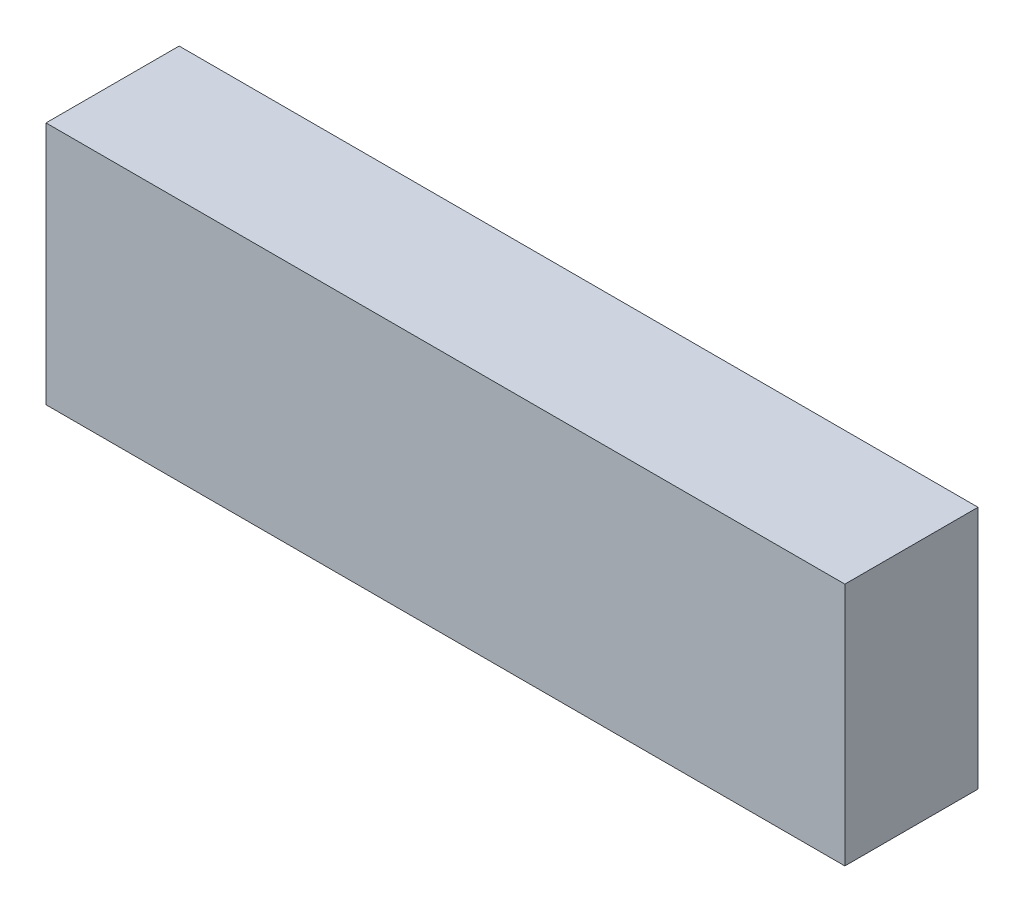
from build123d import *

# Parameters (mm, degrees)
SKETCH1_W           = 180
SKETCH1_H           = 55
BOSS_EXTRUDE1_DEPTH = 30


with BuildPart() as part:
    # Sketch1 → Boss-Extrude1 (new body)
    with BuildSketch(Plane.XY):
        with Locations((14.363839286, 20.513392857)):
            Rectangle(SKETCH1_W, SKETCH1_H)
    extrude(amount=BOSS_EXTRUDE1_DEPTH)


solid = part.part
